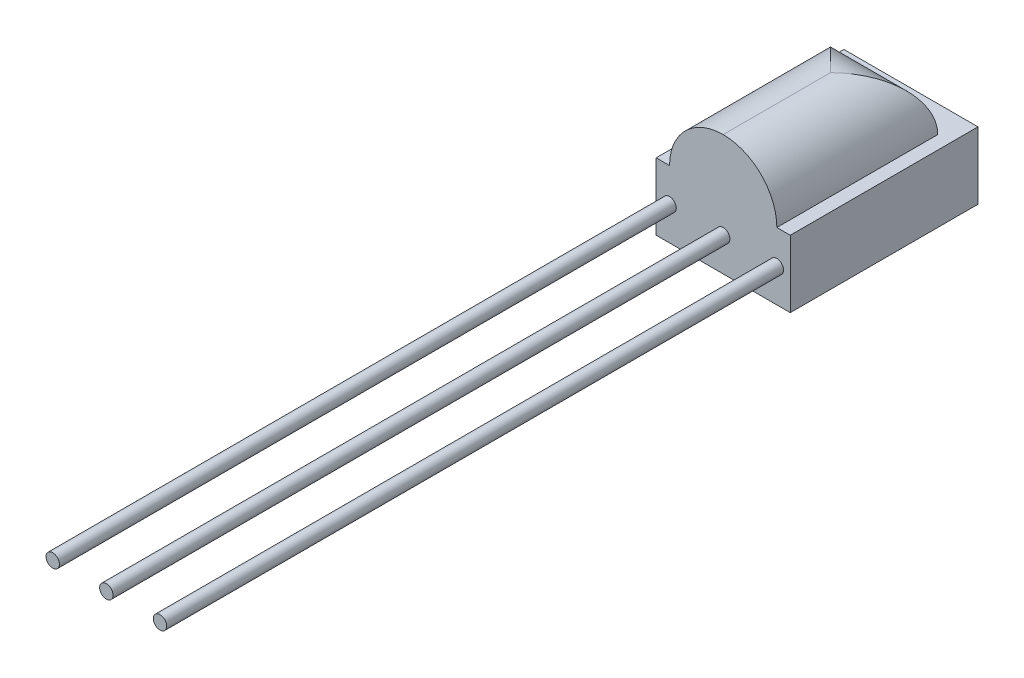
from build123d import *

# Parameters (mm, degrees)
ESQUISSE1_W        = 5
ESQUISSE1_H        = 7
BOSS_EXTRU_1_DEPTH = 2.5
ESQUISSE2_R        = 0.25
BOSS_EXTRU_2_DEPTH = 23
ESQUISSE3_W        = 4
ESQUISSE3_H        = 6
BOSS_EXTRU_3_DEPTH = 2
CONG_1_R           = 2


with BuildPart() as part:
    # Esquisse1 → Boss.-Extru.1 (new body)
    with BuildSketch(Plane(origin=(0, 0, 0), x_dir=(1, 0, 0), z_dir=(0, 1, 0))):
        with Locations((2.5, 3.5)):
            Rectangle(ESQUISSE1_W, ESQUISSE1_H)
    extrude(amount=BOSS_EXTRU_1_DEPTH)

    # Esquisse2 → Boss.-Extru.2 (add)
    with BuildSketch(Plane.XY):
        with Locations(Location((0.5, 1.25, 0), (0, 0, 180))):
            Circle(ESQUISSE2_R)
        with Locations(Location((2.5, 1.25, 0), (0, 0, 180))):
            Circle(ESQUISSE2_R)
        with Locations(Location((4.5, 1.25, 0), (0, 0, 180))):
            Circle(ESQUISSE2_R)
    extrude(amount=BOSS_EXTRU_2_DEPTH)

    # Esquisse3 → Boss.-Extru.3 (add)
    with BuildSketch(Plane(origin=(0, 2.5, 0), x_dir=(1, 0, 0), z_dir=(0, 1, 0))):
        with Locations((2.5, 3)):
            Rectangle(ESQUISSE3_W, ESQUISSE3_H)
    extrude(amount=BOSS_EXTRU_3_DEPTH)

    # Congé1
    cong_1_edges = [part.edges().sort_by_distance(p)[0] for p in [
        (4.5, 4.5, -3),
        (2.5, 4.5, -6),
        (0.5, 4.5, -3),
    ]]
    fillet(cong_1_edges, radius=CONG_1_R - 0.0001)  # a hair under: the kernel refuses the full size


solid = part.part
